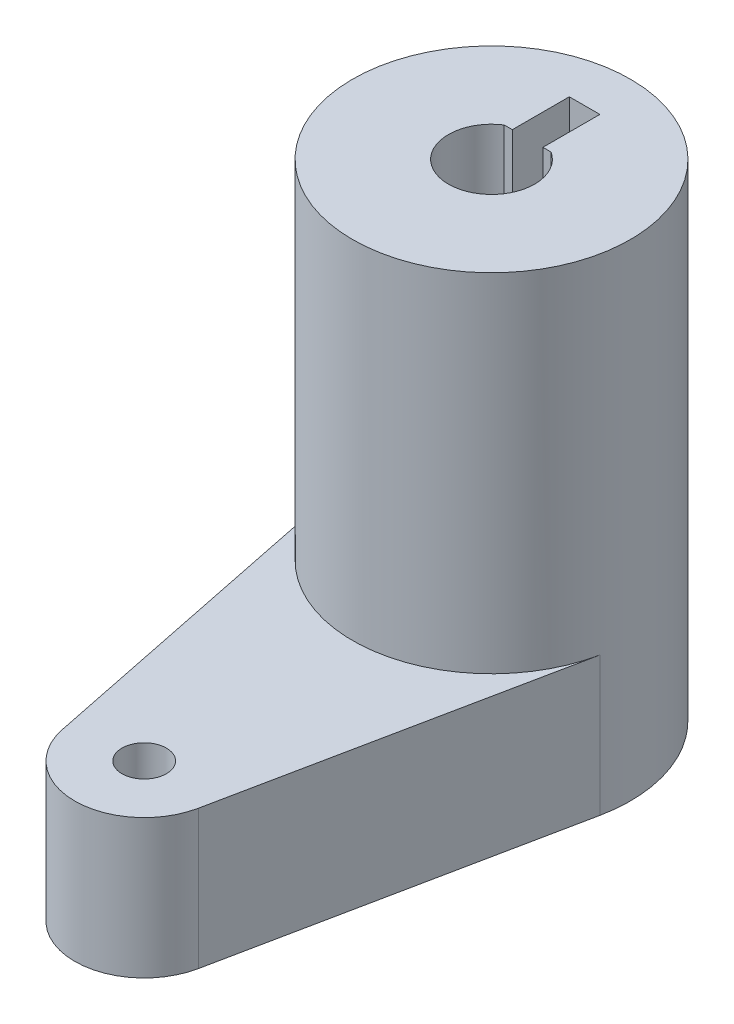
from build123d import *

# Parameters (mm, degrees)
SKETCH_1_R               = 1.6
EXTRUDE_1_DEPTH          = 10
SKETCH_3_R               = 10
EXTRUDE_2_DEPTH          = 25
CUT_EXTRUDE_1_DEPTH      = 41.311288741
CUT_EXTRUDE_1_DEPTH_BACK = 41.311288741


with BuildPart() as part:
    # ｽｹｯﾁ1 → ﾎﾞｽ - 押し出し1 (new body)
    with BuildSketch(Plane(origin=(0, 0, 0), x_dir=(1, 0, 0), z_dir=(0, 1, 0))):
        with BuildLine():
            Line((-9.797958971, -2), (-4.898979486, -26))
            ThreePointArc((-4.898979486, -26), (0, -30), (4.898979486, -26))
            Line((4.898979486, -26), (9.797958971, -2))
            ThreePointArc((9.797958971, -2), (0, 10), (-9.797958971, -2))
        make_face()
        with Locations((0, -25)):
            Circle(SKETCH_1_R, mode=Mode.SUBTRACT)
    extrude(amount=EXTRUDE_1_DEPTH)

    # ｽｹｯﾁ3 → ﾎﾞｽ - 押し出し2 (add)
    with BuildSketch(Plane(origin=(0, 10, 0), x_dir=(1, 0, 0), z_dir=(0, 1, 0))):
        Circle(SKETCH_3_R)
    extrude(amount=EXTRUDE_2_DEPTH)

    # ｽｹｯﾁ2 → ｶｯﾄ - 押し出し1 (cut, two sides: drawn at the far end of the back side and taken through both)
    with BuildSketch(Plane(origin=(0, 10, 0), x_dir=(1, 0, 0), z_dir=(0, 1, 0)).offset(-CUT_EXTRUDE_1_DEPTH_BACK)):
        with BuildLine():
            Line((-1.688194302, 2.6), (-1.1, 2.6))
            Line((-1.1, 2.6), (-1.1, 6.7))
            Line((-1.1, 6.7), (1.1, 6.7))
            Line((1.1, 6.7), (1.1, 2.6))
            Line((1.1, 2.6), (1.688194302, 2.6))
            ThreePointArc((1.688194302, 2.6), (0, -3.1), (-1.688194302, 2.6))
        make_face()
    extrude(amount=CUT_EXTRUDE_1_DEPTH + CUT_EXTRUDE_1_DEPTH_BACK, mode=Mode.SUBTRACT)


solid = part.part
